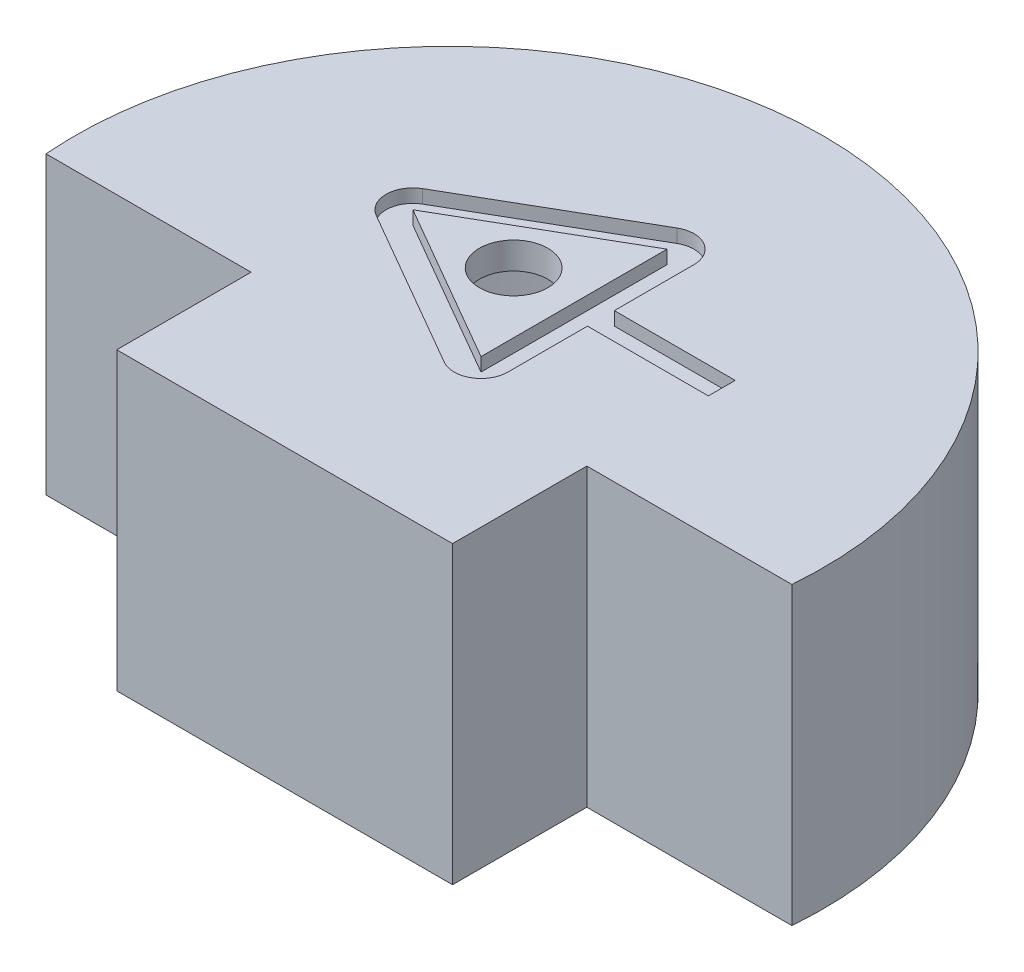
from build123d import *

# Parameters (mm, degrees)
EXTRUIR_L_MINA1_DEPTH        = 20
SALIENTE_EXTRUIR1_DEPTH      = 2
EXTRUIR_L_MINA2_DEPTH        = 2.5
CORTAR_EXTRUIR_L_MINA1_START = -1
CORTAR_EXTRUIR_L_MINA1_DEPTH = 1
CROQUIS11_R                  = 2.55
CORTAR_EXTRUIR1_DEPTH        = 54.553658795


# Read off the part's stored shape, not the designer's step: Cortar-Extruir-Lámina1
with BuildPart() as part:
    # Croquis1 → Extruir-Lámina1 (new body)
    with BuildSketch(Plane(origin=(0, 0, 0), x_dir=(1, 0, 0), z_dir=(0, 1, 0))):
        with BuildLine():
            Line((-27.77, 10), (-12.5, 10))
            Line((-12.5, 10), (-12.5, 0))
            Line((-12.5, 0), (12.5, 0))
            Line((12.5, 0), (12.5, 10))
            Line((12.5, 10), (27.77, 10))
            ThreePointArc((27.77, 10), (0, 40.097565641), (-27.77, 10))
        make_face()
        with BuildLine():
            Line((-25.858908766, 12), (-10.5, 12))
            Line((-10.5, 12), (-10.5, 2))
            Line((-10.5, 2), (10.5, 2))
            Line((10.5, 2), (10.5, 12))
            Line((10.5, 12), (25.858908766, 12))
            ThreePointArc((25.858908766, 12), (0, 38.097565641), (-25.858908766, 12))
        make_face(mode=Mode.SUBTRACT)
    extrude(amount=EXTRUIR_L_MINA1_DEPTH)

    # Croquis2 → Saliente-Extruir1 (add)
    with BuildSketch(Plane(origin=(0, 20, 0), x_dir=(1, 0, 0), z_dir=(0, 1, 0))):
        with BuildLine():
            Line((12.5, 10), (27.77, 10))
            ThreePointArc((27.77, 10), (0, 40.097565641), (-27.77, 10))
            Line((-27.77, 10), (-12.5, 10))
            Line((-12.5, 10), (-12.5, 0))
            Line((-12.5, 0), (12.5, 0))
            Line((12.5, 0), (12.5, 10))
        make_face()
    extrude(amount=SALIENTE_EXTRUIR1_DEPTH)

    # Cortar-Extruir-Lámina1 outline → Cortar-Extruir-Lámina1 (cut)
    with BuildSketch(Plane(origin=(0, 22, 0), x_dir=(1, 0, 0), z_dir=(0, 1, 0)).offset(CORTAR_EXTRUIR_L_MINA1_START)):
        with BuildLine():
            Line((3.5, 13.12057959), (3.5, 19.048782821))
            Line((3.5, 19.048782821), (12.5, 19.048782821))
            Line((12.5, 19.048782821), (12.5, 21.048782821))
            Line((12.5, 21.048782821), (3.5, 21.048782821))
            Line((3.5, 21.048782821), (3.5, 26.976986051))
            ThreePointArc((3.5, 26.976986051), (2.5, 28.709036859), (0.5, 28.709036859))
            Line((0.5, 28.709036859), (-11.5, 21.780833628))
            ThreePointArc((-11.5, 21.780833628), (-12.5, 20.04878282), (-11.5, 18.316732013))
            Line((-11.5, 18.316732013), (0.5, 11.388528783))
            ThreePointArc((0.5, 11.388528783), (2.5, 11.388528783), (3.5, 13.12057959))
        make_face()
        Polygon((-10.5, 20.048782821), (1.5, 26.976986051), (1.5, 13.12057959), align=None, mode=Mode.SUBTRACT)
    extrude(amount=CORTAR_EXTRUIR_L_MINA1_DEPTH, mode=Mode.SUBTRACT)

    # Croquis11 → Cortar-Extruir1 (cut, through all)
    with BuildSketch(Plane(origin=(0, 22, 0), x_dir=(1, 0, 0), z_dir=(0, 1, 0))):
        with Locations(Location((-3, 20.048782821, 0), (0, 0, 270))):
            Circle(CROQUIS11_R)
    extrude(amount=-CORTAR_EXTRUIR1_DEPTH, mode=Mode.SUBTRACT)


with BuildPart() as body_2:
    # Croquis9 → Extruir-Lámina2 (new body)
    with BuildSketch(Plane(origin=(0, 4.9, 0), x_dir=(-1, 0, 0), z_dir=(0, -1, 0))):
        with BuildLine():
            Line((-26.105447319, 11.75), (-10.75, 11.75))
            Line((-10.75, 11.75), (-10.75, 1.75))
            Line((-10.75, 1.75), (10.75, 1.75))
            Line((10.75, 1.75), (10.75, 11.75))
            Line((10.75, 11.75), (26.105447319, 11.75))
            ThreePointArc((26.105447319, 11.75), (0, 38.347565641), (-26.105447319, 11.75))
        make_face()
        with BuildLine():
            Line((-23.524077197, 14.25), (-8.25, 14.25))
            Line((-8.25, 14.25), (-8.25, 4.25))
            Line((-8.25, 4.25), (8.25, 4.25))
            Line((8.25, 4.25), (8.25, 14.25))
            Line((8.25, 14.25), (23.524077197, 14.25))
            ThreePointArc((23.524077197, 14.25), (0, 35.847565641), (-23.524077197, 14.25))
        make_face(mode=Mode.SUBTRACT)
    extrude(amount=EXTRUIR_L_MINA2_DEPTH)


solid = Compound([part.part, body_2.part])
